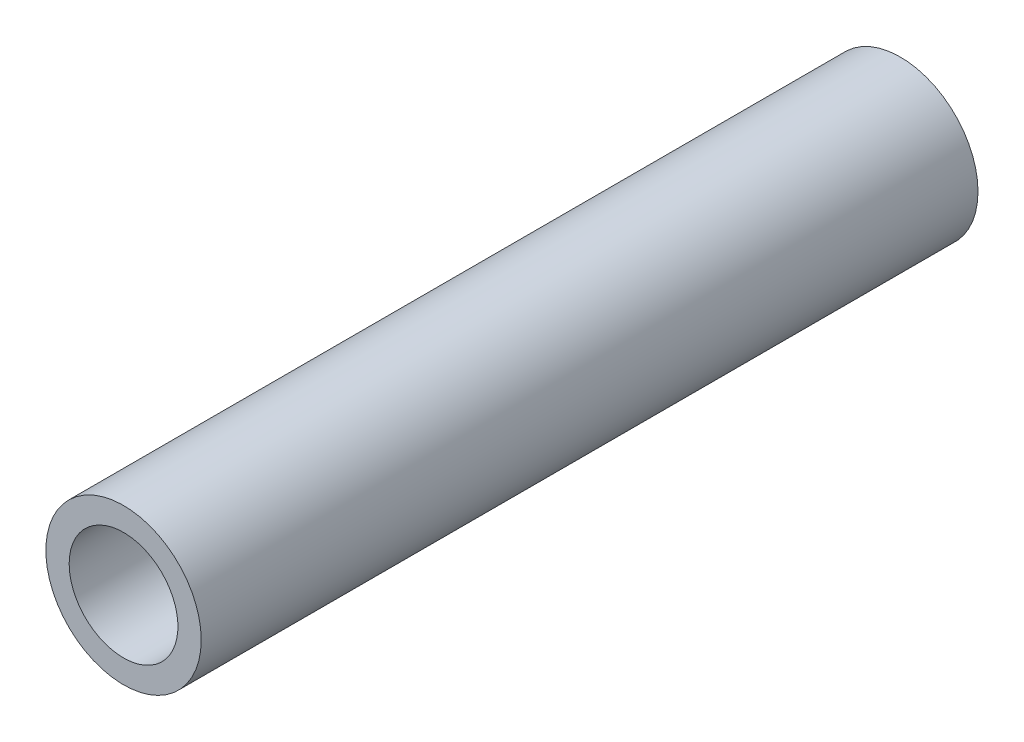
from build123d import *

# Parameters (mm, degrees)
SKETCH1_R              = 10
BOSS_EXTRUDE1_DEPTH    = 100
CUT_EXTRUDE1_OUTLINE_R = 7
CUT_EXTRUDE1_DEPTH     = 100


# Read off the part's stored shape, not the designer's step: Cut-Extrude1
with BuildPart() as part:
    # Sketch1 → Boss-Extrude1 (new body)
    with BuildSketch(Plane.XY):
        Circle(SKETCH1_R)
    extrude(amount=BOSS_EXTRUDE1_DEPTH)

    # Cut-Extrude1 outline → Cut-Extrude1 (cut)
    with BuildSketch(Plane.XY):
        Circle(CUT_EXTRUDE1_OUTLINE_R)
    extrude(amount=CUT_EXTRUDE1_DEPTH, mode=Mode.SUBTRACT)


solid = part.part
